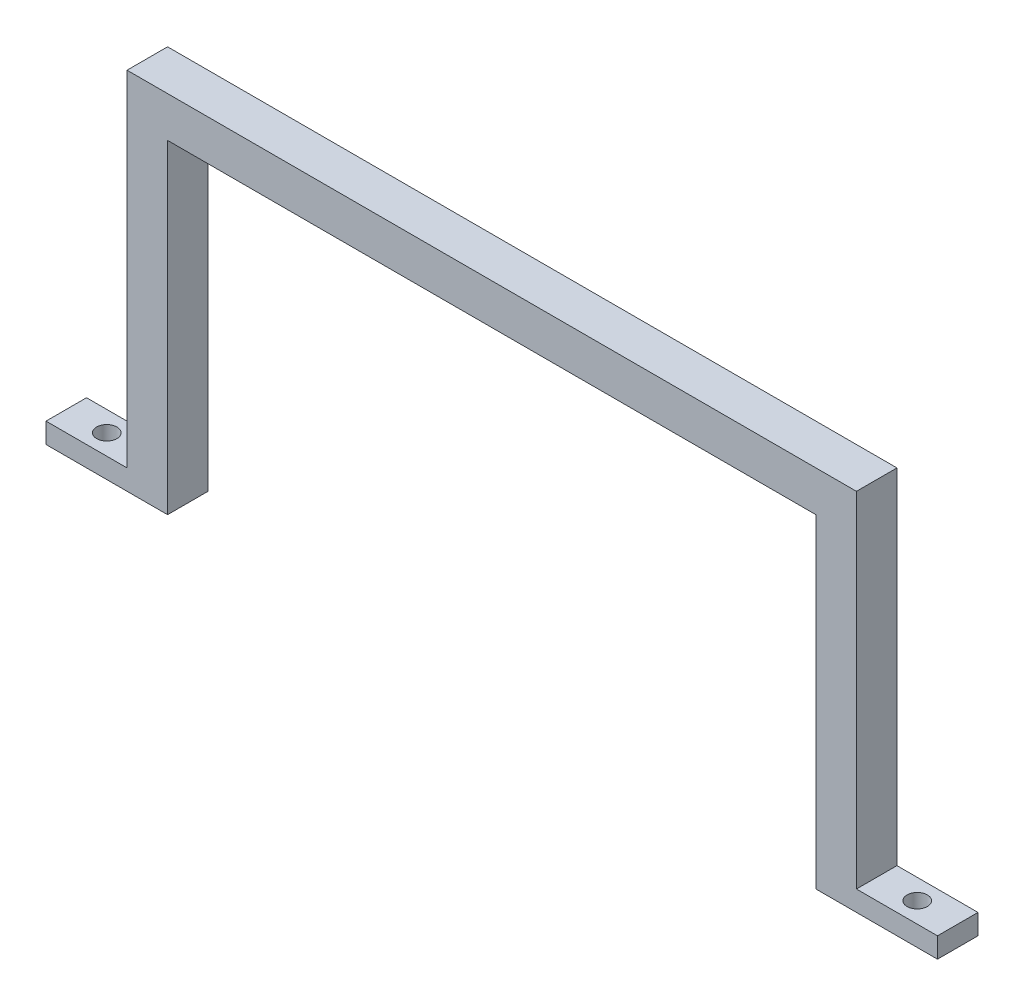
from build123d import *

# Parameters (mm, degrees)
SKETCH1_W           = 114.3
SKETCH1_H           = 6.35
BOSS_EXTRUDE1_DEPTH = 6.35
SKETCH2_W           = 6.35
SKETCH2_H           = 6.35
BOSS_EXTRUDE2_DEPTH = 50.8
SKETCH3_W           = 6.35
SKETCH3_H           = 3.175
BOSS_EXTRUDE3_DEPTH = 12.7
CUT_EXTRUDE1_REACH  = 90.331
SKETCH4_R           = 1.5875


with BuildPart() as part:
    # Sketch1 → Boss-Extrude1 (new body)
    with BuildSketch(Plane(origin=(0, 0, 0), x_dir=(1, 0, 0), z_dir=(0, 1, 0))):
        Rectangle(SKETCH1_W, SKETCH1_H)
    extrude(amount=BOSS_EXTRUDE1_DEPTH)

    # Sketch2 → Boss-Extrude2 (add)
    with BuildSketch(Plane.XZ):
        with Locations((-53.975, 0)):
            Rectangle(SKETCH2_W, SKETCH2_H)
    boss_extrude2 = extrude(amount=BOSS_EXTRUDE2_DEPTH)

    # Sketch3 → Boss-Extrude3 (add)
    with BuildSketch(Plane.ZY.offset(57.15)):
        with Locations((0, -49.2125)):
            Rectangle(SKETCH3_W, SKETCH3_H)
    boss_extrude3 = extrude(amount=BOSS_EXTRUDE3_DEPTH)

    # Mirror1: Boss-Extrude2, Boss-Extrude3 across plane
    add(boss_extrude2.mirror(Plane(origin=(0, 0, 0), x_dir=(0, 0, 1), z_dir=(1, 0, 0))))
    add(boss_extrude3.mirror(Plane(origin=(0, 0, 0), x_dir=(0, 0, 1), z_dir=(1, 0, 0))))

    # Sketch4 → Cut-Extrude1 (cut, up to next)
    with BuildSketch(Plane(origin=(0, -47.625, 0), x_dir=(1, 0, 0), z_dir=(0, 1, 0)), mode=Mode.PRIVATE) as cut_extrude1_sk1:
        with Locations((-63.5, 0)):
            Circle(SKETCH4_R)
    cut_extrude1_tool1 = extrude(cut_extrude1_sk1.sketch, amount=-CUT_EXTRUDE1_REACH, mode=Mode.PRIVATE) & part.part
    cut_extrude1 = cut_extrude1_tool1.solids().sort_by_distance((-63.5, -47.625, 0))[0]
    add(cut_extrude1, mode=Mode.SUBTRACT)

    # Mirror2: Cut-Extrude1 across plane
    add(cut_extrude1.mirror(Plane(origin=(0, 0, 0), x_dir=(0, 0, 1), z_dir=(1, 0, 0))), mode=Mode.SUBTRACT)


solid = part.part
